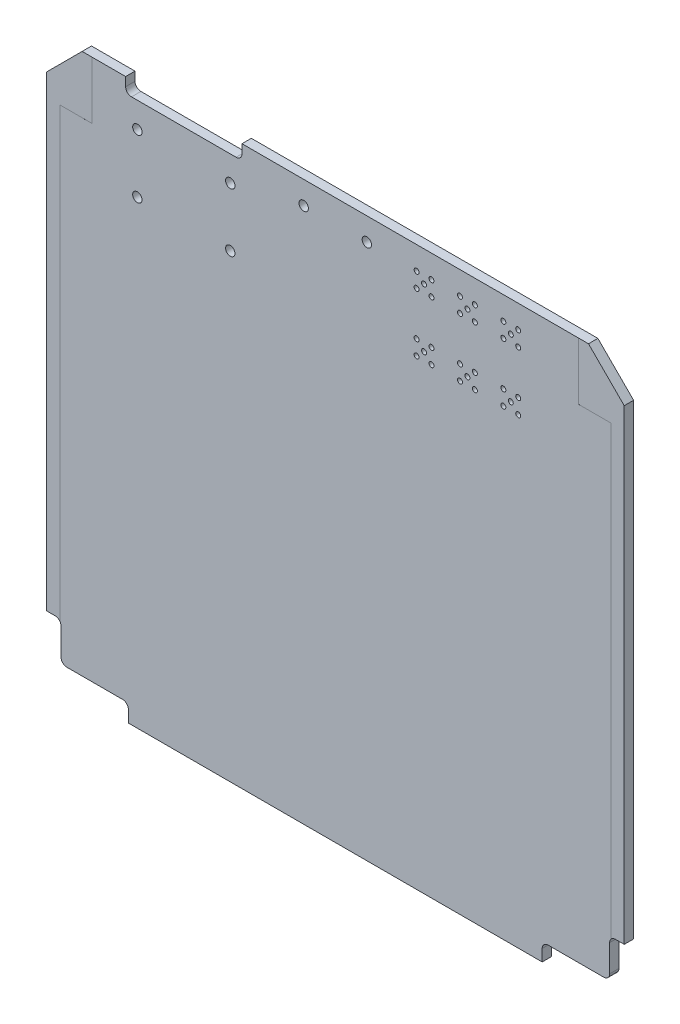
from build123d import *

# Parameters (mm, degrees)
SKETCH1_R                = 0.425
BOSS_EXTRUDE1_DEPTH      = 1.6
LPATTERN2_START          = -0.0125
LPATTERN2_OUTLINE_R      = 0.425
LPATTERN2_DEPTH          = 1.6
SLOTFOOTPRINTS_REF_DEPTH = 0.0001
SLOTFOOTPRINTS_DEPTH     = 0.0001
SKETCH2_R                = 0.8
F_20PIN_MOUNTS_DEPTH     = 71.235674696
SKETCH3_R                = 0.8
F_12PIN_MOUNTS_DEPTH     = 10


# Read off the part's stored shape, not the designer's step: LPattern2
with BuildPart() as part:
    # Sketch1 → Boss-Extrude1 (new body)
    with BuildSketch(Plane(origin=(0, 0, -0.0125), x_dir=(-1, 0, 0), z_dir=(0, 0, -1))):
        with BuildLine():
            Line((35.3, -50), (35.3, -48))
            ThreePointArc((35.3, -48), (35.592893219, -47.292893219), (36.3, -47))
            Line((36.3, -47), (45.8, -47))
            ThreePointArc((45.8, -47), (46.507106781, -46.707106781), (46.8, -46))
            Line((46.8, -46), (46.8, -41.4))
            ThreePointArc((46.8, -41.4), (47.092893219, -40.692893219), (47.8, -40.4))
            Line((47.8, -40.4), (49.3, -40.4))
            Line((49.3, -40.4), (49.3, 39.2))
            Line((49.3, 39.2), (43.2, 45.3))
            Line((43.2, 45.3), (35.500000002, 45.3))
            Line((35.500000002, 45.3), (3.499999998, 45.3))
            Line((3.499999998, 45.3), (-43.2, 45.3))
            Line((-43.2, 45.3), (-49.3, 39.2))
            Line((-49.3, 39.2), (-49.3, -40.4))
            Line((-49.3, -40.4), (-47.8, -40.4))
            ThreePointArc((-47.8, -40.4), (-47.092893219, -40.692893219), (-46.8, -41.4))
            Line((-46.8, -41.4), (-46.8, -46))
            ThreePointArc((-46.8, -46), (-46.507106781, -46.707106781), (-45.8, -47))
            Line((-45.8, -47), (-36.3, -47))
            ThreePointArc((-36.3, -47), (-35.592893219, -47.292893219), (-35.3, -48))
            Line((-35.3, -48), (-35.3, -50))
            Line((-35.3, -50), (35.3, -50))
        make_face()
        with Locations(Location((-21.27, 41.37, 0), (0, 0, 180))):
            Circle(SKETCH1_R, mode=Mode.SUBTRACT)
        with Locations(Location((-23.81, 41.37, 0), (0, 0, 180))):
            Circle(SKETCH1_R, mode=Mode.SUBTRACT)
        with Locations(Location((-22.54, 40.1, 0), (0, 0, 180))):
            Circle(SKETCH1_R, mode=Mode.SUBTRACT)
        with Locations(Location((-13.87, 41.37, 0), (0, 0, 180))):
            Circle(SKETCH1_R, mode=Mode.SUBTRACT)
        with Locations(Location((-23.81, 38.83, 0), (0, 0, 180))):
            Circle(SKETCH1_R, mode=Mode.SUBTRACT)
        with Locations(Location((-16.41, 41.37, 0), (0, 0, 180))):
            Circle(SKETCH1_R, mode=Mode.SUBTRACT)
        with Locations(Location((-15.14, 40.1, 0), (0, 0, 180))):
            Circle(SKETCH1_R, mode=Mode.SUBTRACT)
        with Locations(Location((-21.27, 38.83, 0), (0, 0, 180))):
            Circle(SKETCH1_R, mode=Mode.SUBTRACT)
        with Locations(Location((-28.67, 41.37, 0), (0, 0, 180))):
            Circle(SKETCH1_R, mode=Mode.SUBTRACT)
        with Locations(Location((-31.21, 41.37, 0), (0, 0, 180))):
            Circle(SKETCH1_R, mode=Mode.SUBTRACT)
        with Locations(Location((-16.41, 38.83, 0), (0, 0, 180))):
            Circle(SKETCH1_R, mode=Mode.SUBTRACT)
        with Locations(Location((-29.94, 40.1, 0), (0, 0, 180))):
            Circle(SKETCH1_R, mode=Mode.SUBTRACT)
        with Locations(Location((-31.21, 38.83, 0), (0, 0, 180))):
            Circle(SKETCH1_R, mode=Mode.SUBTRACT)
        with Locations(Location((-28.67, 38.83, 0), (0, 0, 180))):
            Circle(SKETCH1_R, mode=Mode.SUBTRACT)
        with Locations(Location((-13.87, 38.83, 0), (0, 0, 180))):
            Circle(SKETCH1_R, mode=Mode.SUBTRACT)
    extrude(amount=-BOSS_EXTRUDE1_DEPTH)

    # LPattern2 outline → LPattern2 (cut)
    with BuildSketch(Plane.XY.offset(LPATTERN2_START)):
        with Locations((31.21, 31.37)):
            Circle(LPATTERN2_OUTLINE_R)
        with Locations((31.21, 28.83)):
            Circle(LPATTERN2_OUTLINE_R)
        with Locations((29.94, 30.1)):
            Circle(LPATTERN2_OUTLINE_R)
        with Locations((28.67, 28.83)):
            Circle(LPATTERN2_OUTLINE_R)
        with Locations((28.67, 31.37)):
            Circle(LPATTERN2_OUTLINE_R)
        with Locations((16.41, 31.37)):
            Circle(LPATTERN2_OUTLINE_R)
        with Locations((23.81, 31.37)):
            Circle(LPATTERN2_OUTLINE_R)
        with Locations((23.81, 28.83)):
            Circle(LPATTERN2_OUTLINE_R)
        with Locations((22.54, 30.1)):
            Circle(LPATTERN2_OUTLINE_R)
        with Locations((21.27, 28.83)):
            Circle(LPATTERN2_OUTLINE_R)
        with Locations((21.27, 31.37)):
            Circle(LPATTERN2_OUTLINE_R)
        with Locations((16.41, 28.83)):
            Circle(LPATTERN2_OUTLINE_R)
        with Locations((15.14, 30.1)):
            Circle(LPATTERN2_OUTLINE_R)
        with Locations((13.87, 28.83)):
            Circle(LPATTERN2_OUTLINE_R)
        with Locations((13.87, 31.37)):
            Circle(LPATTERN2_OUTLINE_R)
    extrude(amount=LPATTERN2_DEPTH, mode=Mode.SUBTRACT)

    # thermalContacts_lower → slotFootprints_REF (cut)
    with BuildSketch(Plane(origin=(0, 0, -0.0125), x_dir=(-1, 0, 0), z_dir=(0, 0, -1))):
        Polygon((47, 35.5), (47, -41.5), (59.827263463, -41.5), (59.827263463, 47), (41.5, 47), (41.5, 41.5), (41.5, 35.5), align=None)
        Polygon((-47, 35.5), (-47, -41.5), (-56.192158269, -41.5), (-56.192158269, 47), (-41.5, 47), (-41.5, 41.5), (-41.5, 35.5), align=None)
    extrude(amount=-SLOTFOOTPRINTS_REF_DEPTH, mode=Mode.SUBTRACT)

    # thermalContacts_upper → slotFootprints (cut)
    with BuildSketch(Plane.XY.offset(1.5875)):
        Polygon((-47, 35.5), (-47, -41.5), (-56.192158269, -41.5), (-56.192158269, 47), (-41.5, 47), (-41.5, 41.5), (-41.5, 35.5), align=None)
        Polygon((47, 35.5), (47, -41.5), (59.827263463, -41.5), (59.827263463, 47), (41.5, 47), (41.5, 41.5), (41.5, 35.5), align=None)
    extrude(amount=-SLOTFOOTPRINTS_DEPTH, mode=Mode.SUBTRACT)

    # Sketch2 → 20pin_mounts (cut, through all)
    with BuildSketch(Plane.XY.offset(1.5875)):
        with Locations((-33.775, 38.472296419)):
            Circle(SKETCH2_R)
        with Locations((-17.925, 38.472296419)):
            Circle(SKETCH2_R)
        with Locations((-17.925, 28.472296419)):
            Circle(SKETCH2_R)
        with Locations((-33.775, 28.472296419)):
            Circle(SKETCH2_R)
        with BuildLine():
            Line((-35.775, 45.3), (-35.775, 43.8))
            ThreePointArc((-35.775, 43.8), (-35.482106781, 43.092893219), (-34.775, 42.8))
            Line((-34.775, 42.8), (-16.925, 42.8))
            ThreePointArc((-16.925, 42.8), (-16.217893218, 43.092893219), (-15.925, 43.8))
            Line((-15.925, 43.8), (-15.925, 45.3))
            Line((-15.925, 45.3), (-35.775, 45.3))
        make_face()
    extrude(amount=-F_20PIN_MOUNTS_DEPTH, mode=Mode.SUBTRACT)

    # Sketch3 → 12pin_mounts (cut)
    with BuildSketch(Plane(origin=(0, 0, -0.0125), x_dir=(-1, 0, 0), z_dir=(0, 0, -1))):
        with Locations((5.390000006, 41.4)):
            Circle(SKETCH3_R)
        with Locations((-5.379999994, 41.4)):
            Circle(SKETCH3_R)
    extrude(amount=-F_12PIN_MOUNTS_DEPTH, mode=Mode.SUBTRACT)


solid = part.part
